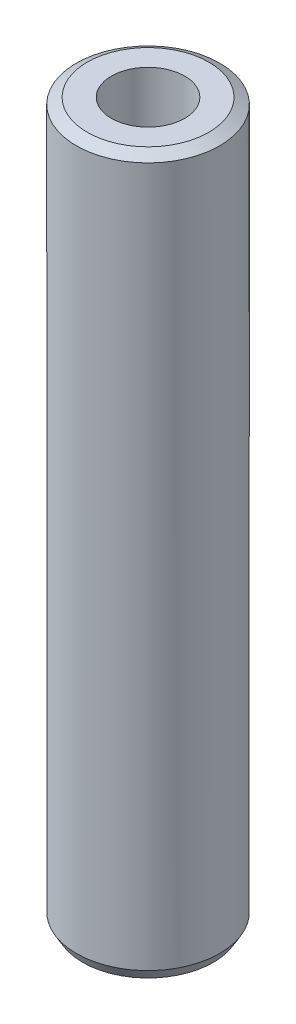
from build123d import *
from OCP.BRepFilletAPI import BRepFilletAPI_MakeChamfer

# Parameters (mm, degrees)
SKETCH1_R           = 60
BOSS_EXTRUDE1_DEPTH = 600
SKETCH2_R           = 30.692938019
CUT_EXTRUDE1_DEPTH  = 606.970296302
CHAMFER1_SIZE       = 5.246149573
CHAMFER1_SIZE2      = 9.086597604


with BuildPart() as part:
    # Sketch1 → Boss-Extrude1 (new body)
    with BuildSketch(Plane(origin=(0, 0, 0), x_dir=(1, 0, 0), z_dir=(0, 1, 0))):
        Circle(SKETCH1_R)
    extrude(amount=BOSS_EXTRUDE1_DEPTH)

    # Sketch2 → Cut-Extrude1 (cut, through all)
    with BuildSketch(Plane(origin=(0, 0, 0), x_dir=(1, 0, 0), z_dir=(0, 1, 0))):
        Circle(SKETCH2_R)
    extrude(amount=CUT_EXTRUDE1_DEPTH, mode=Mode.SUBTRACT)

    # Chamfer1: one chamfer whose edges measure the first distance from different faces: ONE call of the kernel's chamfer builder (chamfer() names one face for all edges)
    chamfer1_edges_1 = [part.edges().sort_by_distance(p)[0] for p in [
        (-60, 600, 0),
    ]]
    chamfer1_side_1 = [part.faces().sort_by_distance(p)[0] for p in [
        (-60, 300, 0),
    ]]
    chamfer1_edges_2 = [part.edges().sort_by_distance(p)[0] for p in [
        (-60, 0, 0),
    ]]
    chamfer1_side_2 = [part.faces().sort_by_distance(p)[0] for p in [
        (-58.302943725, 0, 0),
    ]]
    chamfer1 = BRepFilletAPI_MakeChamfer(part.part.solid().wrapped)
    for e in chamfer1_edges_1:
        chamfer1.Add(CHAMFER1_SIZE, CHAMFER1_SIZE2, e.wrapped, chamfer1_side_1[0].wrapped)  # the first distance lies on this face
    for e in chamfer1_edges_2:
        chamfer1.Add(CHAMFER1_SIZE, CHAMFER1_SIZE2, e.wrapped, chamfer1_side_2[0].wrapped)  # the first distance lies on this face
    add(Compound.cast(chamfer1.Shape()), mode=Mode.REPLACE)


solid = part.part
